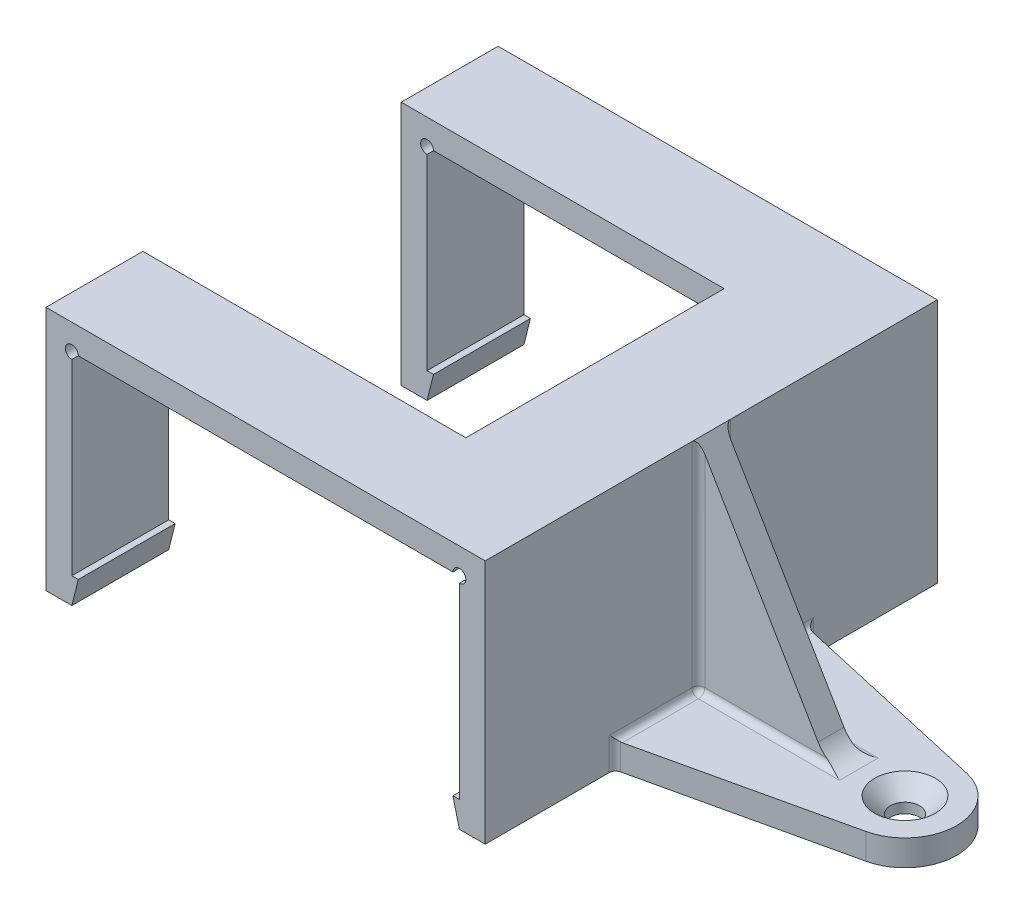
from build123d import *

# Parameters (mm, degrees)
FORME_PRINCIPALE_DEPTH = 35
ESQUISSE3_W            = 50
ESQUISSE3_H            = 40
VIDEMENT_DEPTH         = 86.399063227
BOSSAGE_CROU_DEPTH     = 4
NERVURE3_REACH         = 119.919
ESQUISSE9_WALL_W       = 277.285093932
ESQUISSE9_WALL_H       = 4
CONG_2_R               = 1
CONG_3_R               = 5


with BuildPart() as part:
    # Esquisse1 → Forme principale (new, symmetric)
    with BuildSketch(Plane.XY):
        with BuildLine():
            Line((0, -38), (0, 0))
            Line((0, 0), (68, 0))
            Line((68, 0), (68, -38))
            Line((68, -38), (64, -38))
            Line((64, -38), (63, -34))
            Line((63, -34), (64, -34))
            Line((64, -34), (64, -5))
            ThreePointArc((64, -5), (64.707106781, -3.292893219), (63, -4))
            Line((63, -4), (5, -4))
            ThreePointArc((5, -4), (3.292893219, -3.292893219), (4, -5))
            Line((4, -5), (4, -34))
            Line((4, -34), (5, -34))
            Line((5, -34), (4, -38))
            Line((4, -38), (0, -38))
        make_face()
    extrude(amount=FORME_PRINCIPALE_DEPTH, both=True)

    # Esquisse3 → videment (cut, through all)
    with BuildSketch(Plane(origin=(0, 0, 0), x_dir=(1, 0, 0), z_dir=(0, 1, 0))):
        with Locations((25, 0)):
            Rectangle(ESQUISSE3_W, ESQUISSE3_H)
    extrude(amount=-VIDEMENT_DEPTH, mode=Mode.SUBTRACT)

    # Esquisse4 → Bossage écrou (add)
    with BuildSketch(Plane.XZ.offset(38)):
        with BuildLine():
            Line((68, 15), (99.767786128, 7.802238923))
            ThreePointArc((99.767786128, 7.802238923), (106, 0), (99.767786128, -7.802238923))
            Line((99.767786128, -7.802238923), (68, -15))
            Line((68, -15), (68, 15))
        make_face()
    extrude(amount=-BOSSAGE_CROU_DEPTH)

    # Esquisse7 → Fraisage pour vis à tête fraisée M41 (revolve, cut)
    with BuildSketch(Plane(origin=(98, -34, 0), x_dir=(0, 0, 1), z_dir=(1, 0, 0))):
        Polygon((0, 0), (0, 4.00005), (2.25, 4.00005), (2.25, 2.45), (4.7, 0), align=None)
    revolve(axis=Axis((98, -27.65, 0), (0, -1, 0)), mode=Mode.SUBTRACT)

    # Esquisse9 wall → Nervure3 (add, up to next)
    with BuildSketch(Plane(origin=(78, -17, 0), x_dir=(0.507020126563, -0.861934215158, 0), z_dir=(0.861934215158, 0.507020126563, 0)), mode=Mode.PRIVATE) as nervure3_sk1:
        Rectangle(ESQUISSE9_WALL_W, ESQUISSE9_WALL_H)
    nervure3_tool1 = extrude(nervure3_sk1.sketch, amount=-NERVURE3_REACH, mode=Mode.PRIVATE) - part.part
    add(nervure3_tool1.solids().sort_by_distance((78, -17, 0))[0])

    # Congé2
    cong_2_edges = [part.edges().sort_by_distance(p)[0] for p in [
        (68, -34, -8.5),
        (78, -34, -2),
        (68, -17, -2),
        (78, -34, 2),
        (68, -34, 8.5),
        (68, -17, 2),
        (68, -36, -15),
        (68, -36, 15),
    ]]
    fillet(cong_2_edges, radius=CONG_2_R)

    # Congé3
    cong_3_edges = [part.edges().sort_by_distance(p)[0] for p in [
        (88, -34, 0),
    ]]
    fillet(cong_3_edges, radius=CONG_3_R)


solid = part.part
